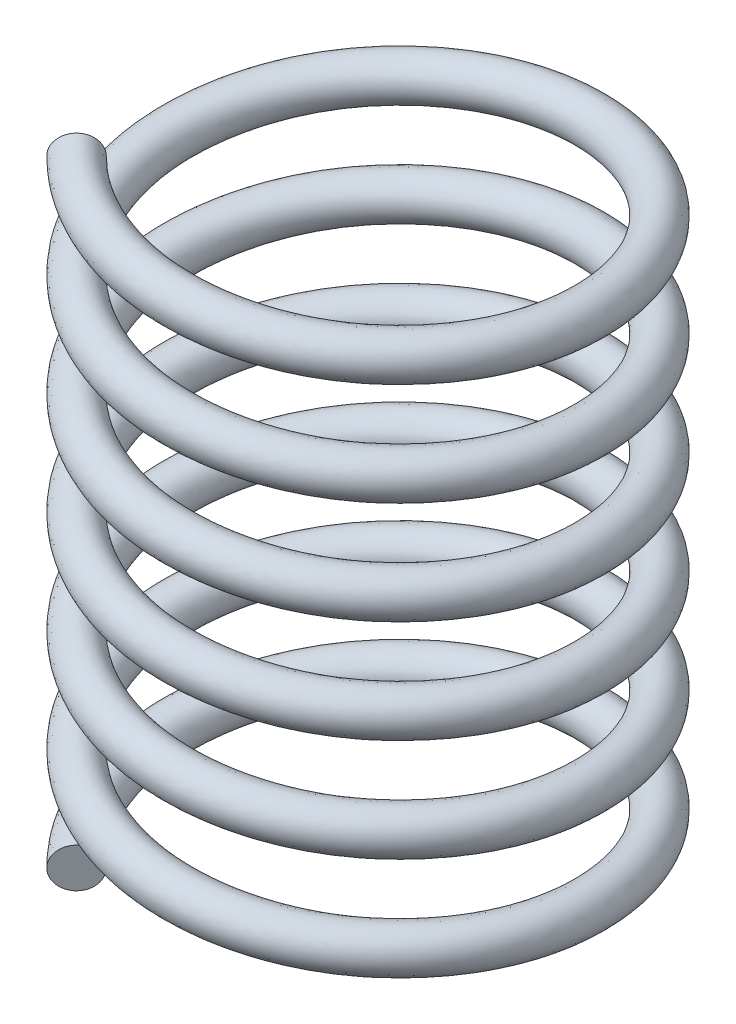
from build123d import *

# Parameters (mm, degrees)
SWEEP1_PITCH       = 1.5875
SWEEP1_HEIGHT      = 9.525
SWEEP1_RADIUS      = 3.175
SWEEP1_START_ANGLE = -45
SKETCH4_R          = 0.325


with BuildPart() as part:
    # Sweep1: sweep along a helix
    with BuildLine() as sweep1_path:
        add(Helix(SWEEP1_PITCH, SWEEP1_HEIGHT, SWEEP1_RADIUS, center=(0, 0, 0), direction=(0, 1, 0), lefthand=True, mode=Mode.PRIVATE).rotate(Axis((0, 0, 0), (0, 1, 0)), SWEEP1_START_ANGLE))
    # Sketch4 → Sweep1 (sweep)
    with BuildSketch(Plane(origin=(-2.24506403, 0, 2.24506403), x_dir=(-0.6978150386002157, 0.10076403548886581, 0.7091549767542905), z_dir=(-0.704878455894312, 0.07932669684365838, -0.7048784558942945))):
        with Locations((0.00928562, 0.003561064)):
            Circle(SKETCH4_R)
    sweep(path=sweep1_path.line, is_frenet=True)


solid = part.part
